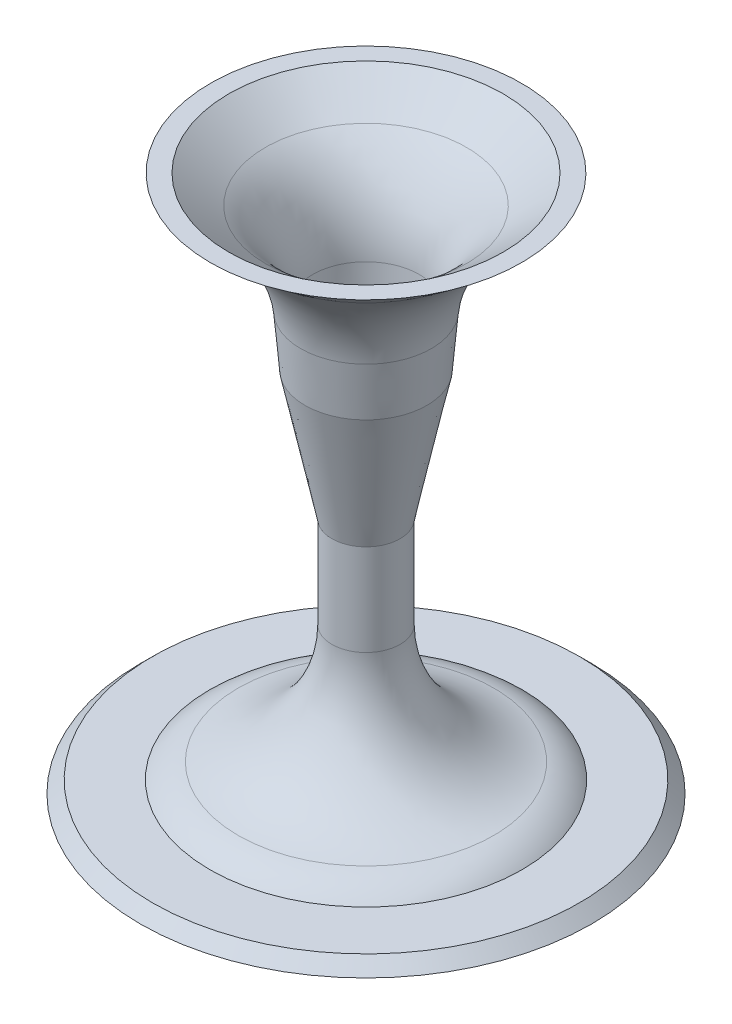
from build123d import *

# Parameters (mm, degrees)
FILLET1_R = 10


with BuildPart() as part:
    # Sketch1 → Revolve2 (revolve)
    with BuildSketch(Plane.XY, mode=Mode.PRIVATE) as revolve2_sk:
        with BuildLine():
            Line((-3.59, -36.15), (-3.59, -21.15))
            Line((-3.59, -21.15), (-8, 0))
            Line((-8, 0), (-8.766277994, 9.195335924))
            ThreePointArc((-8.766277994, 9.195335924), (-11.137120078, 17.107504902), (-16.502977942, 23.386906109))
            Line((-16.502977942, 23.386906109), (-22.5, 28))
            Line((-22.5, 28), (-25.5, 28))
            Line((-25.5, 28), (-18.455600302, 22.584866513))
            ThreePointArc((-18.455600302, 22.584866513), (-13.092321233, 16.315659868), (-10.71591345, 8.415001644))
            Line((-10.71591345, 8.415001644), (-10.003752773, 0))
            Line((-10.003752773, 0), (-5.59, -21.15))
            Line((-5.59, -21.15), (-5.59, -36.15))
            ThreePointArc((-5.59, -36.15), (-11.447864376, -50.292135624), (-25.59, -56.15))
            Line((-25.59, -56.15), (-25.59, -58.15))
            Line((-25.59, -58.15), (-35, -58.15))
            Line((-35, -58.15), (-37, -60.15))
            Line((-37, -60.15), (0, -60.15))
            Line((0, -60.15), (0, -58.15))
            Line((0, -58.15), (-3.59, -36.15))
        make_face()
        with BuildLine():
            Line((-16.42484861, -56.15), (-16.42484861, -58.15))
            Line((-16.42484861, -58.15), (-2.026453361, -58.15))
            Line((-2.026453361, -58.15), (-4.561439674, -42.615264931))
            ThreePointArc((-4.561439674, -42.615264931), (-9.045746613, -50.651299247), (-16.42484861, -56.15))
        make_face(mode=Mode.SUBTRACT)
    revolve(revolve2_sk.sketch.rotate(Axis((0, 74.39046888, 0), (0, -1, 0)), 270), axis=Axis((0, 74.39046888, 0), (0, -1, 0)))

    # Fillet1
    # the kernel refuses this fillet: 10 mm, written as the material it takes off along each edge
    with BuildSketch(Plane(origin=(0, -56.15, 0), x_dir=(0, 0, 1), z_dir=(1, 0, 0))) as fillet1_piece_1:
        with BuildLine():
            CenterArc((18.631445006, 9.181818182), FILLET1_R, 283.412011605, 30.683417109)
            Line((25.59, 2), (25.7291711, 1.856363636))
            ThreePointArc((25.7291711, 1.856363636), (25.79, 1), (25.79, 0))
            Line((25.79, 0), (25.59, -0.2))
            ThreePointArc((25.59, -0.2), (23.277858136, -0.335463392), (20.997353704, -0.74))
            Line((20.997353704, -0.74), (20.950963337, -0.545454545))
        make_face()
    revolve(axis=Axis((0, -56.15, 0), (0, -1, 0)), mode=Mode.SUBTRACT)


solid = part.part
